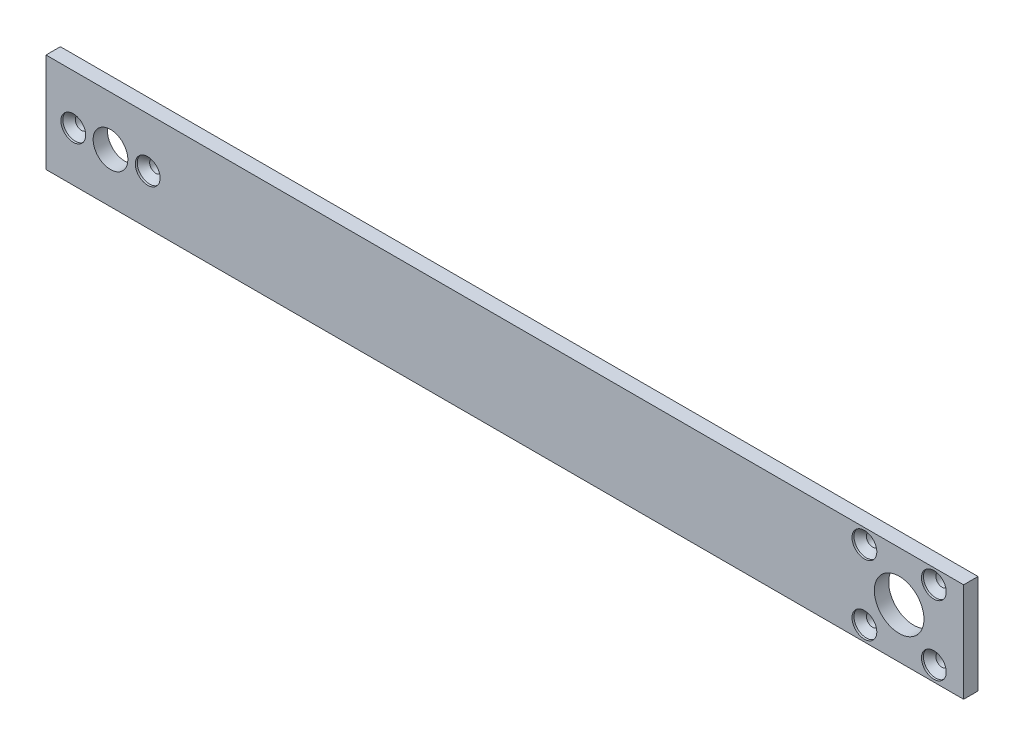
from build123d import *

# Parameters (mm, degrees)
SKETCH1_W                                      = 185
SKETCH1_H                                      = 20
BASE_SHAPE_DEPTH                               = 2.9
MOTOR_CUTOUTS_REACH                            = 95.084
SKETCH2_R                                      = 1.25
SKETCH2_R_2                                    = 3.5
SKETCH2_R_3                                    = 5
CSK_FOR_M2_5_FLAT_HEAD_MACHINE_SCREW1_AT_COUNT = 2
CSK_FOR_M2_5_FLAT_HEAD_MACHINE_SCREW1_AT_PITCH = 15
CSK_FOR_M2_5_FLAT_HEAD_MACHINE_SCREW_2_COUNT   = 2
CSK_FOR_M2_5_FLAT_HEAD_MACHINE_SCREW_2_PITCH   = 159.653531123
CSK_FOR_M2_5_FLAT_HEAD_MACHINE_SCREW_3_COUNT   = 2
CSK_FOR_M2_5_FLAT_HEAD_MACHINE_SCREW_3_PITCH   = 173.641152956
CSK_FOR_M2_5_FLAT_HEAD_MACHINE_SCREW_4_COUNT   = 2
CSK_FOR_M2_5_FLAT_HEAD_MACHINE_SCREW_4_PITCH   = 159.653531123
CSK_FOR_M2_5_FLAT_HEAD_MACHINE_SCREW_5_COUNT   = 2
CSK_FOR_M2_5_FLAT_HEAD_MACHINE_SCREW_5_PITCH   = 173.641152956


with BuildPart() as part:
    # Sketch1 → Base shape (new body)
    with BuildSketch(Plane.XY):
        Rectangle(SKETCH1_W, SKETCH1_H)
    extrude(amount=-BASE_SHAPE_DEPTH)

    # Sketch2 → Motor cutouts (cut, up to next)
    with BuildSketch(Plane.XY, mode=Mode.PRIVATE) as motor_cutouts_sk1:
        with Locations((-87, 0)):
            Circle(SKETCH2_R)
    motor_cutouts_tool1 = extrude(motor_cutouts_sk1.sketch, amount=-MOTOR_CUTOUTS_REACH, mode=Mode.PRIVATE) & part.part
    # Sketch2 → Motor cutouts (cut, up to next)
    with BuildSketch(Plane.XY, mode=Mode.PRIVATE) as motor_cutouts_sk2:
        with Locations((-72, 0)):
            Circle(SKETCH2_R)
    motor_cutouts_tool2 = extrude(motor_cutouts_sk2.sketch, amount=-MOTOR_CUTOUTS_REACH, mode=Mode.PRIVATE) & part.part
    # Sketch2 → Motor cutouts (cut, up to next)
    with BuildSketch(Plane.XY, mode=Mode.PRIVATE) as motor_cutouts_sk3:
        with Locations((-79.5, 0)):
            Circle(SKETCH2_R_2)
    motor_cutouts_tool3 = extrude(motor_cutouts_sk3.sketch, amount=-MOTOR_CUTOUTS_REACH, mode=Mode.PRIVATE) & part.part
    # Sketch2 → Motor cutouts (cut, up to next)
    with BuildSketch(Plane.XY, mode=Mode.PRIVATE) as motor_cutouts_sk4:
        with Locations((79.5, 0)):
            Circle(SKETCH2_R_3)
    motor_cutouts_tool4 = extrude(motor_cutouts_sk4.sketch, amount=-MOTOR_CUTOUTS_REACH, mode=Mode.PRIVATE) & part.part
    # Sketch2 → Motor cutouts (cut, up to next)
    with BuildSketch(Plane.XY, mode=Mode.PRIVATE) as motor_cutouts_sk5:
        with Locations((72.5, 7)):
            Circle(SKETCH2_R)
    motor_cutouts_tool5 = extrude(motor_cutouts_sk5.sketch, amount=-MOTOR_CUTOUTS_REACH, mode=Mode.PRIVATE) & part.part
    # Sketch2 → Motor cutouts (cut, up to next)
    with BuildSketch(Plane.XY, mode=Mode.PRIVATE) as motor_cutouts_sk6:
        with Locations((86.5, 7)):
            Circle(SKETCH2_R)
    motor_cutouts_tool6 = extrude(motor_cutouts_sk6.sketch, amount=-MOTOR_CUTOUTS_REACH, mode=Mode.PRIVATE) & part.part
    # Sketch2 → Motor cutouts (cut, up to next)
    with BuildSketch(Plane.XY, mode=Mode.PRIVATE) as motor_cutouts_sk7:
        with Locations((86.5, -7)):
            Circle(SKETCH2_R)
    motor_cutouts_tool7 = extrude(motor_cutouts_sk7.sketch, amount=-MOTOR_CUTOUTS_REACH, mode=Mode.PRIVATE) & part.part
    # Sketch2 → Motor cutouts (cut, up to next)
    with BuildSketch(Plane.XY, mode=Mode.PRIVATE) as motor_cutouts_sk8:
        with Locations((72.5, -7)):
            Circle(SKETCH2_R)
    motor_cutouts_tool8 = extrude(motor_cutouts_sk8.sketch, amount=-MOTOR_CUTOUTS_REACH, mode=Mode.PRIVATE) & part.part
    add(motor_cutouts_tool1.solids().sort_by_distance((-87, 0, 0))[0], mode=Mode.SUBTRACT)
    add(motor_cutouts_tool2.solids().sort_by_distance((-72, 0, 0))[0], mode=Mode.SUBTRACT)
    add(motor_cutouts_tool3.solids().sort_by_distance((-79.5, 0, 0))[0], mode=Mode.SUBTRACT)
    add(motor_cutouts_tool4.solids().sort_by_distance((79.5, 0, 0))[0], mode=Mode.SUBTRACT)
    add(motor_cutouts_tool5.solids().sort_by_distance((72.5, 7, 0))[0], mode=Mode.SUBTRACT)
    add(motor_cutouts_tool6.solids().sort_by_distance((86.5, 7, 0))[0], mode=Mode.SUBTRACT)
    add(motor_cutouts_tool7.solids().sort_by_distance((86.5, -7, 0))[0], mode=Mode.SUBTRACT)
    add(motor_cutouts_tool8.solids().sort_by_distance((72.5, -7, 0))[0], mode=Mode.SUBTRACT)

    # Sketch4 → CSK for M2.5 Flat Head Machine Screw1 (revolve, cut)
    with BuildSketch(Plane(origin=(-87, 0, 0), x_dir=(0, -1, 0), z_dir=(1, 0, 0))):
        Polygon((0, 0), (0, 2.9), (1.25, 2.9), (1.25, 1.65), (2.5, 0.4), (2.5, 0), align=None)
    csk_for_m2_5_flat_head_machine_screw1 = revolve(axis=Axis((-87, 0, 6.35), (0, 0, -1)), mode=Mode.SUBTRACT)

    # CSK for M2.5 Flat Head Machine Screw1 at: CSK for M2.5 Flat Head Machine Screw1 ×2
    with Locations(*[(i * CSK_FOR_M2_5_FLAT_HEAD_MACHINE_SCREW1_AT_PITCH, 0, 0) for i in range(1, CSK_FOR_M2_5_FLAT_HEAD_MACHINE_SCREW1_AT_COUNT)]):
        add(csk_for_m2_5_flat_head_machine_screw1, mode=Mode.SUBTRACT)

    # CSK for M2.5 Flat Head Machine Screw 2: CSK for M2.5 Flat Head Machine Screw1 ×2
    with Locations(*[Vector(0.9990383480917311, 0.04384494317643957, 0) * (i * CSK_FOR_M2_5_FLAT_HEAD_MACHINE_SCREW_2_PITCH) for i in range(1, CSK_FOR_M2_5_FLAT_HEAD_MACHINE_SCREW_2_COUNT)]):
        add(csk_for_m2_5_flat_head_machine_screw1, mode=Mode.SUBTRACT)

    # CSK for M2.5 Flat Head Machine Screw 3: CSK for M2.5 Flat Head Machine Screw1 ×2
    with Locations(*[Vector(0.9991870996367137, 0.04031302419283568, 0) * (i * CSK_FOR_M2_5_FLAT_HEAD_MACHINE_SCREW_3_PITCH) for i in range(1, CSK_FOR_M2_5_FLAT_HEAD_MACHINE_SCREW_3_COUNT)]):
        add(csk_for_m2_5_flat_head_machine_screw1, mode=Mode.SUBTRACT)

    # CSK for M2.5 Flat Head Machine Screw 4: CSK for M2.5 Flat Head Machine Screw1 ×2
    with Locations(*[Vector(0.9990383480917311, -0.04384494317643962, 0) * (i * CSK_FOR_M2_5_FLAT_HEAD_MACHINE_SCREW_4_PITCH) for i in range(1, CSK_FOR_M2_5_FLAT_HEAD_MACHINE_SCREW_4_COUNT)]):
        add(csk_for_m2_5_flat_head_machine_screw1, mode=Mode.SUBTRACT)

    # CSK for M2.5 Flat Head Machine Screw 5: CSK for M2.5 Flat Head Machine Screw1 ×2
    with Locations(*[Vector(0.9991870996367137, -0.0403130241928357, 0) * (i * CSK_FOR_M2_5_FLAT_HEAD_MACHINE_SCREW_5_PITCH) for i in range(1, CSK_FOR_M2_5_FLAT_HEAD_MACHINE_SCREW_5_COUNT)]):
        add(csk_for_m2_5_flat_head_machine_screw1, mode=Mode.SUBTRACT)


solid = part.part
